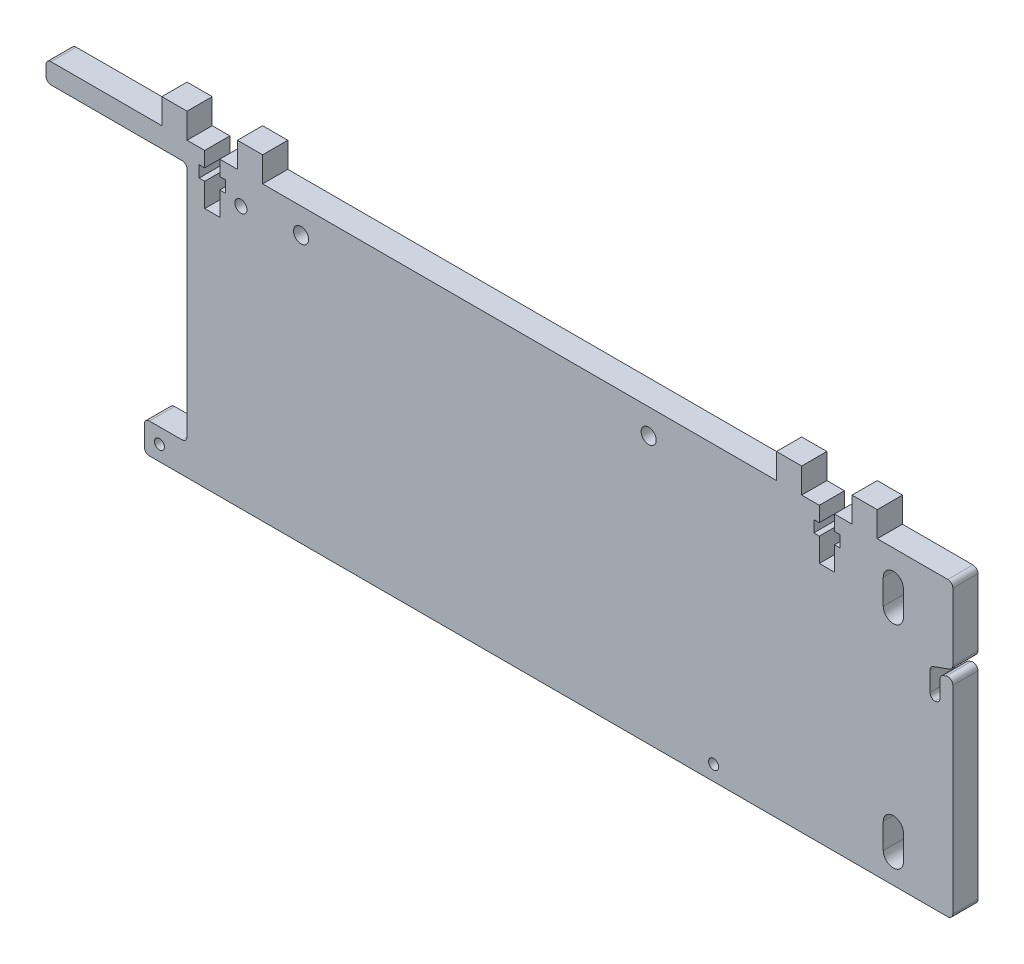
from build123d import *

# Parameters (mm, degrees)
ESQUISSE1_R             = 1
ESQUISSE1_R_2           = 1.2
ESQUISSE1_R_3           = 1.5
BOSS_EXTRU_1_DEPTH      = 5
ENL_V_MAT_EXTRU_1_DEPTH = 108.186752913
CONG_1_R                = 1


with BuildPart() as part:
    # Esquisse1 → Boss.-Extru.1 (new body)
    with BuildSketch(Plane.XY):
        Polygon((-67, 5), (-67, 0), (-90, 0), (-90, -4), (-62, -4), (-62, -52), (-70.4817, -52), (-70.4817, -58), (-62, -58), (90, -58), (90, 0), (75, 0), (75, 5), (70, 5), (70, 0), (66.5, 0), (66.5, -3), (67.6, -3), (67.6, -5.3), (66.5, -5.3), (66.5, -10), (63.5, -10), (63.5, -5.3), (62.4, -5.3), (62.4, -3), (63.5, -3), (63.5, 0), (60, 0), (60, 5), (55, 5), (55, 0), (-47, 0), (-47, 5), (-52, 5), (-52, 0), (-55.5, 0), (-55.5, -3), (-54.4, -3), (-54.4, -5.3), (-55.5, -5.3), (-55.5, -10), (-58.5, -10), (-58.5, -5.3), (-59.6, -5.3), (-59.6, -3), (-58.5, -3), (-58.5, 0), (-62, 0), (-62, 5), align=None)
        with Locations((-67.4817, -55)):
            Circle(ESQUISSE1_R, mode=Mode.SUBTRACT)
        with Locations((42.5183, -55)):
            Circle(ESQUISSE1_R, mode=Mode.SUBTRACT)
        with Locations((-51.30915, -6)):
            Circle(ESQUISSE1_R_2, mode=Mode.SUBTRACT)
        with Locations((-39.3683, -5)):
            Circle(ESQUISSE1_R_3, mode=Mode.SUBTRACT)
        with Locations((29.6317, -5)):
            Circle(ESQUISSE1_R_3, mode=Mode.SUBTRACT)
        with Locations((78.19085, -6)):
            Circle(ESQUISSE1_R_2, mode=Mode.SUBTRACT)
    extrude(amount=BOSS_EXTRU_1_DEPTH)

    # Esquisse2 → Enlèv. mat.-Extru.1 (cut, through all)
    with BuildSketch(Plane(origin=(0, 0, 0), x_dir=(-1, 0, 0), z_dir=(0, 0, -1))):
        Polygon((-90, -16.277013327), (-87.46, -17.201497722), (-87.46, -22.201497722), (-85.46, -22.201497722), (-85.46, -16.652424864), (-90, -15), align=None)
        with BuildLine():
            Line((-76.19085, -6), (-76.19085, -11))
            ThreePointArc((-76.19085, -11), (-78.19085, -13), (-80.19085, -11))
            Line((-80.19085, -11), (-80.19085, -6))
            ThreePointArc((-80.19085, -6), (-78.19085, -4), (-76.19085, -6))
        make_face()
        with BuildLine():
            Line((-76.19085, -48), (-76.19085, -53))
            ThreePointArc((-76.19085, -53), (-78.19085, -55), (-80.19085, -53))
            Line((-80.19085, -53), (-80.19085, -48))
            ThreePointArc((-80.19085, -48), (-78.19085, -46), (-76.19085, -48))
        make_face()
    extrude(amount=-ENL_V_MAT_EXTRU_1_DEPTH, mode=Mode.SUBTRACT)

    # Congé1
    cong_1_edges = [part.edges().sort_by_distance(p)[0] for p in [
        (85.46, -16.652424864, 2.5),
        (90, -15, 2.5),
        (90, -16.277013327, 2.5),
        (87.46, -17.201497722, 2.5),
        (87.46, -22.201497722, 2.5),
        (85.46, -22.201497722, 2.5),
        (90, -58, 2.5),
        (90, 0, 2.5),
        (-90, 0, 2.5),
        (-90, -4, 2.5),
        (-62, -4, 2.5),
        (-62, -52, 2.5),
        (-70.4817, -58, 2.5),
        (-70.4817, -52, 2.5),
    ]]
    fillet(cong_1_edges, radius=CONG_1_R - 0.0001)  # a hair under: the kernel refuses the full size


solid = part.part
